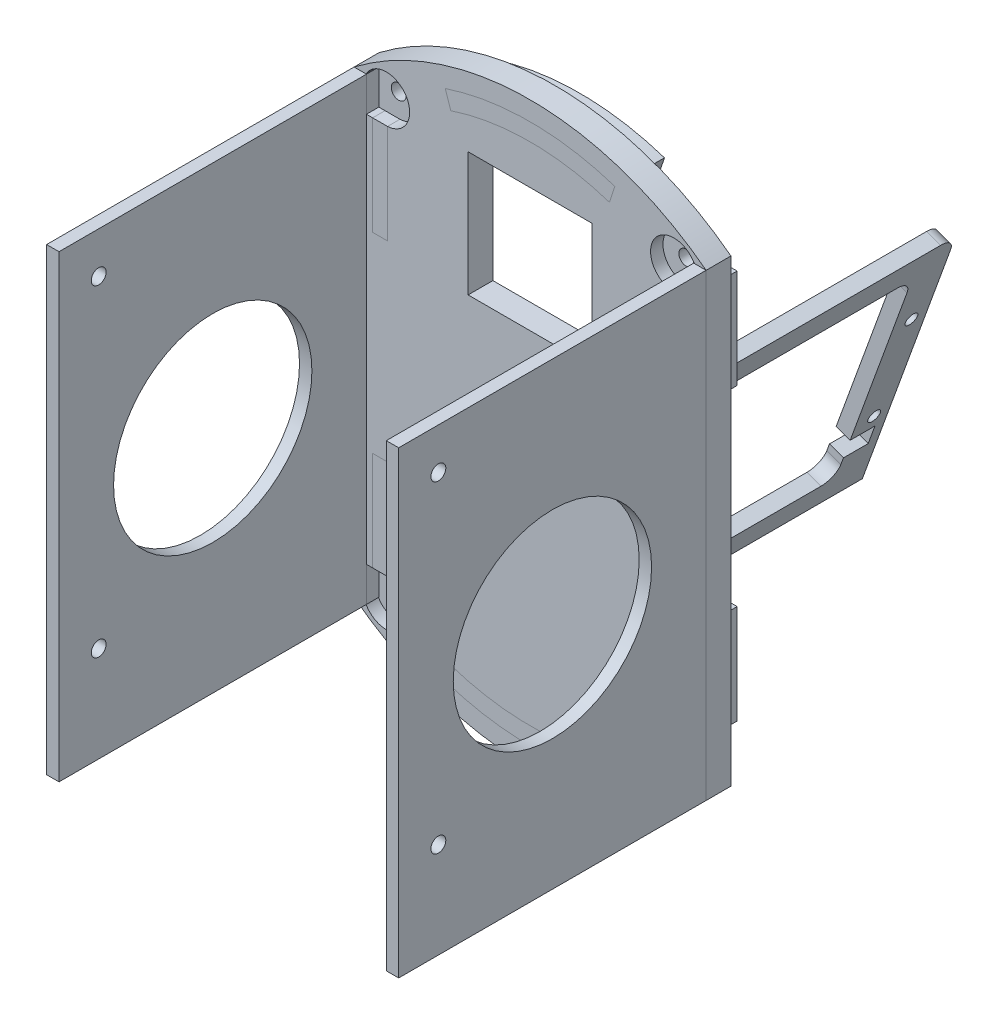
from build123d import *

# Parameters (mm, degrees)
SKETCH_3_6_R             = 1.5
SKETCH_3_6_W             = 3
SKETCH_3_6_H             = 20
SKETCH_3_6_W_2           = 25
SKETCH_3_6_H_2           = 25
EXTRUDE_4_DEPTH          = 5
EXTRUDE_START            = -65
EXTRUDE_7_DEPTH          = 65
EXTRUDE_6_DEPTH          = 62
EXTRUDE_6_2_DEPTH        = 62
SKETCH_4_R               = 1.25
CUT_EXTRUDE_2_DEPTH      = 3
CUT_EXTRUDE_3_DEPTH      = 95.282501027
CUT_EXTRUDE_3_DEPTH_BACK = 95.282501027
SKETCH_7_R               = 20
SKETCH_7_R_2             = 1.5
SKETCH_3_R               = 1.5
CUT_EXTRUDE_4_DEPTH      = 2.5
SKETCH_3_12_W            = 3
SKETCH_3_12_H            = 20
EXTRUDE_8_DEPTH          = 10
EXTRUDE_8_2_DEPTH        = 10
EXTRUDE_8_3_DEPTH        = 10
EXTRUDE_8_4_DEPTH        = 10
EXTRUDE_8_5_DEPTH        = 10
EXTRUDE_8_6_DEPTH        = 10
FILLET_1_R               = 3
FILLET_5_R               = 5
SKETCH_4_4_W             = 10
SKETCH_4_4_H             = 8
CUT_EXTRUDE_5_DEPTH      = 10


# Read off the part's stored shape, not the designer's step: 凸台-拉伸7
with BuildPart() as part:
    # 草图3<6> → 凸台-拉伸4 (new body)
    with BuildSketch(Plane.XY):
        with BuildLine():
            Line((-35.5, 46.3), (-35.5, -46.3))
            ThreePointArc((-35.5, -46.3), (0, -58.343294388), (35.5, -46.3))
            Line((35.5, -46.3), (35.5, 46.3))
            ThreePointArc((35.5, 46.3), (0, 58.343294388), (-35.5, 46.3))
        make_face()
        with Locations((-29, -44)):
            Circle(SKETCH_3_6_R, mode=Mode.SUBTRACT)
        with Locations((-30.25, -29.3)):
            Rectangle(SKETCH_3_6_W, SKETCH_3_6_H, mode=Mode.SUBTRACT)
        with BuildLine():
            ThreePointArc((17.098039216, -51.748498094), (0, -54.5), (-17.098039216, -51.748498094))
            Line((-17.098039216, -51.748498094), (-16, -48.425200051))
            ThreePointArc((-16, -48.425200051), (0, -51), (16, -48.425200051))
            Line((16, -48.425200051), (17.098039216, -51.748498094))
        make_face(mode=Mode.SUBTRACT)
        with Locations((29, -44)):
            Circle(SKETCH_3_6_R, mode=Mode.SUBTRACT)
        with Locations((30.25, -29.3)):
            Rectangle(SKETCH_3_6_W, SKETCH_3_6_H, mode=Mode.SUBTRACT)
        Polygon((1.854035127, -39.3), (1.5, -39.3), (1.5, -31.967851465), (17.99601501, 13.354577287), (20.815092873, 12.328516857), (2.00398499, -39.354577287), align=None, mode=Mode.SUBTRACT)
        with Locations((-30.25, 29.3)):
            Rectangle(SKETCH_3_6_W, SKETCH_3_6_H, mode=Mode.SUBTRACT)
        with Locations((-29, 44)):
            Circle(SKETCH_3_6_R, mode=Mode.SUBTRACT)
        with Locations((0, 30.5)):
            Rectangle(SKETCH_3_6_W_2, SKETCH_3_6_H_2, mode=Mode.SUBTRACT)
        with BuildLine():
            ThreePointArc((-17.098039216, 51.748498094), (0, 54.5), (17.098039216, 51.748498094))
            Line((17.098039216, 51.748498094), (16, 48.425200051))
            ThreePointArc((16, 48.425200051), (0, 51), (-16, 48.425200051))
            Line((-16, 48.425200051), (-17.098039216, 51.748498094))
        make_face(mode=Mode.SUBTRACT)
        with Locations((30.25, 29.3)):
            Rectangle(SKETCH_3_6_W, SKETCH_3_6_H, mode=Mode.SUBTRACT)
        with Locations((29, 44)):
            Circle(SKETCH_3_6_R, mode=Mode.SUBTRACT)
    extrude(amount=-EXTRUDE_4_DEPTH)

    # 凸台-拉伸7 outline → 凸台-拉伸7 (add)
    with BuildSketch(Plane.XY.offset(EXTRUDE_START)):
        Polygon((-0.815092873, -38.328516857), (1.5, -39.171141752), (1.5, -39.3), (1.854035127, -39.3), (2.00398499, -39.354577287), (20.815092873, 12.328516857), (17.99601501, 13.354577287), align=None)
    extrude(amount=EXTRUDE_7_DEPTH)

    # 草图4 → 切除-拉伸2 (cut)
    with BuildSketch(Plane(origin=(14.41788061, -5.247679383, 0), x_dir=(0, 0, -1), z_dir=(0.9396926207859095, -0.34202014332566566, 0))):
        Polygon((63, -23), (58, -23), (58, 13.5), (13, 13.5), (13, -31.5), (58, -31.5), (58, -27), (63, -27), align=None)
        with Locations(Location((10, -20, 0), (0, 0, 90))):
            Circle(SKETCH_4_R)
        with Locations(Location((10, 2, 0), (0, 0, 90))):
            Circle(SKETCH_4_R)
        with Locations(Location((61.8, -20, 0), (0, 0, 90))):
            Circle(SKETCH_4_R)
        with Locations(Location((61.8, 2, 0), (0, 0, 90))):
            Circle(SKETCH_4_R)
    extrude(amount=-CUT_EXTRUDE_2_DEPTH, mode=Mode.SUBTRACT)

    # 草图3 → 切除-拉伸4 (cut)
    # profile 1 of 8: a face of its own
    with BuildSketch(Plane.XY):
        with BuildLine():
            Line((-24.893602552, 46.3), (-33, 46.3))
            Line((-33, 46.3), (-33, 39.3))
            Line((-33, 39.3), (-31.75, 39.3))
            Line((-31.75, 39.3), (-28.75, 39.3))
            ThreePointArc((-28.75, 39.3), (-24.877555376, 41.728887867), (-24.893602552, 46.3))
        make_face()
        with Locations((-29, 44)):
            Circle(SKETCH_3_R, mode=Mode.SUBTRACT)
    # profile 2 of 8: a face of its own
    with BuildSketch(Plane.XY):
        with BuildLine():
            ThreePointArc((-26.20469003, 47.786653162), (-29.991096362, 48.601111605), (-33.106397448, 46.3))
            Line((-33.106397448, 46.3), (-33, 46.3))
            Line((-33, 46.3), (-24.893602552, 46.3))
            ThreePointArc((-24.893602552, 46.3), (-25.469996356, 47.113129338), (-26.20469003, 47.786653162))
        make_face()
    # profile 3 of 8: a face of its own
    with BuildSketch(Plane.XY):
        with BuildLine():
            Line((33, 39.3), (33, 46.3))
            Line((33, 46.3), (24.893602552, 46.3))
            ThreePointArc((24.893602552, 46.3), (24.877555376, 41.728887867), (28.75, 39.3))
            Line((28.75, 39.3), (31.75, 39.3))
            Line((31.75, 39.3), (33, 39.3))
        make_face()
        with Locations((29, 44)):
            Circle(SKETCH_3_R, mode=Mode.SUBTRACT)
    # profile 4 of 8: a face of its own
    with BuildSketch(Plane.XY):
        with BuildLine():
            Line((33, 46.3), (33.106397448, 46.3))
            ThreePointArc((33.106397448, 46.3), (29.991096362, 48.601111605), (26.20469003, 47.786653162))
            ThreePointArc((26.20469003, 47.786653162), (25.469996356, 47.113129338), (24.893602552, 46.3))
            Line((24.893602552, 46.3), (33, 46.3))
        make_face()
    # profile 5 of 8: a face of its own
    with BuildSketch(Plane.XY):
        with BuildLine():
            Line((24.893602552, -46.3), (33, -46.3))
            Line((33, -46.3), (33, -39.3))
            Line((33, -39.3), (31.75, -39.3))
            Line((31.75, -39.3), (28.75, -39.3))
            ThreePointArc((28.75, -39.3), (24.877555376, -41.728887867), (24.893602552, -46.3))
        make_face()
        with Locations((29, -44)):
            Circle(SKETCH_3_R, mode=Mode.SUBTRACT)
    # profile 6 of 8: a face of its own
    with BuildSketch(Plane.XY):
        with BuildLine():
            ThreePointArc((26.20469003, -47.786653162), (29.991096362, -48.601111605), (33.106397448, -46.3))
            Line((33.106397448, -46.3), (33, -46.3))
            Line((33, -46.3), (24.893602552, -46.3))
            ThreePointArc((24.893602552, -46.3), (25.469996356, -47.113129338), (26.20469003, -47.786653162))
        make_face()
    # profile 7 of 8: a face of its own
    with BuildSketch(Plane.XY):
        with BuildLine():
            Line((-33, -39.3), (-33, -46.3))
            Line((-33, -46.3), (-24.893602552, -46.3))
            ThreePointArc((-24.893602552, -46.3), (-24.877555376, -41.728887867), (-28.75, -39.3))
            Line((-28.75, -39.3), (-31.75, -39.3))
            Line((-31.75, -39.3), (-33, -39.3))
        make_face()
        with Locations((-29, -44)):
            Circle(SKETCH_3_R, mode=Mode.SUBTRACT)
    # profile 8 of 8: a face of its own
    with BuildSketch(Plane.XY):
        with BuildLine():
            Line((-33, -46.3), (-33.106397448, -46.3))
            ThreePointArc((-33.106397448, -46.3), (-29.991096362, -48.601111605), (-26.20469003, -47.786653162))
            ThreePointArc((-26.20469003, -47.786653162), (-25.469996356, -47.113129338), (-24.893602552, -46.3))
            Line((-24.893602552, -46.3), (-33, -46.3))
        make_face()
    extrude(amount=-CUT_EXTRUDE_4_DEPTH, mode=Mode.SUBTRACT)

    # 圆角1
    fillet_1_edges = [part.edges().sort_by_distance(p)[0] for p in [
        (0.342453564, -38.749829304, -65),
        (19.405553942, 12.841547072, -65),
        (17.625613613, 7.951201212, -13),
        (17.625613613, 7.951201212, -58),
        (2.234707164, -34.334966723, -58),
        (2.234707164, -34.334966723, -13),
    ]]
    fillet(fillet_1_edges, radius=FILLET_1_R)

    # 圆角5
    # the kernel refuses this fillet: 5 mm, written as the material it adds along each edge
    with BuildSketch(Plane(origin=(20.815092873, 12.328516857, -5), x_dir=(4.0352212111646156e-11, -1.4687004095435187e-11, -1.0), z_dir=(-0.3420201433256656, -0.9396926207859095, 0))) as fillet_5_piece_1_section:
        with BuildLine():
            CenterArc((FILLET_5_R, FILLET_5_R), FILLET_5_R, 179.999999998, 90)
            Line((FILLET_5_R * 4.29419272013e-11, FILLET_5_R), (0, 0))
            Line((0, 0), (FILLET_5_R, 0))
        make_face()
    fillet_5_piece_1 = extrude(amount=55, mode=Mode.PRIVATE)
    fillet_5_piece_1 = fillet_5_piece_1 - Plane(origin=(8.643311737, -24.429463647, -10), x_dir=(0.34202014332566566, 0.9396926207859095, 0), z_dir=(0.9396926207859095, -0.34202014332566566, 0)) * Cylinder(1.25, 131, mode=Mode.PRIVATE)
    fillet_5_piece_1 = fillet_5_piece_1 - Plane(origin=(16.16775489, -3.75622599, -10), x_dir=(0.34202014332566566, 0.9396926207859095, 0), z_dir=(0.9396926207859095, -0.34202014332566566, 0)) * Cylinder(1.25, 131, mode=Mode.PRIVATE)
    add(fillet_5_piece_1)

    # 草图4<4> → 切除-拉伸5 (cut)
    with BuildSketch(Plane(origin=(14.41788061, -5.247679383, 0), x_dir=(0, 0, -1), z_dir=(0.9396926207859095, -0.34202014332566566, 0))):
        with Locations((10, -20)):
            Rectangle(SKETCH_4_4_W, SKETCH_4_4_H)
        with Locations((10, 2)):
            Rectangle(SKETCH_4_4_W, SKETCH_4_4_H)
    extrude(amount=CUT_EXTRUDE_5_DEPTH, mode=Mode.SUBTRACT)


with BuildPart() as body_2:
    # 草图3<8> → 凸台-拉伸6 (new body)
    with BuildSketch(Plane.XY):
        Polygon((-35.5, 46.3), (-35.5, -46.3), (-33.106397448, -46.3), (-33, -46.3), (-33, -39.3), (-33, 39.3), (-33, 46.3), (-33.106397448, 46.3), align=None)
    extrude(amount=EXTRUDE_6_DEPTH)


with BuildPart() as body_3:
    # 草图3<8> → Extrude 6 2 (new body)
    with BuildSketch(Plane.XY):
        Polygon((33.106397448, -46.3), (35.5, -46.3), (35.5, 46.3), (33.106397448, 46.3), (33, 46.3), (33, 39.3), (33, -39.3), (33, -46.3), align=None)
    extrude(amount=EXTRUDE_6_2_DEPTH)


with BuildPart() as cut_extrude_3_tool:
    # 草图7 → 切除-拉伸3 (new, two sides: drawn at the far end of the back side and taken through both)
    with BuildSketch(Plane(origin=(0, 0, 0), x_dir=(0, 0, -1), z_dir=(1, 0, 0)).offset(-CUT_EXTRUDE_3_DEPTH_BACK)):
        with Locations((-31, 0)):
            Circle(SKETCH_7_R)
        with Locations((-54, 38)):
            Circle(SKETCH_7_R_2)
        with Locations((-54, -27)):
            Circle(SKETCH_7_R_2)
    extrude(amount=CUT_EXTRUDE_3_DEPTH + CUT_EXTRUDE_3_DEPTH_BACK)


with BuildPart() as body_2_1:
    add(body_2.part)

    # 切除-拉伸3: cut by cut_extrude_3_tool
    add(cut_extrude_3_tool.part, mode=Mode.SUBTRACT)


with BuildPart() as body_3_1:
    add(body_3.part)

    # 切除-拉伸3: cut by cut_extrude_3_tool
    add(cut_extrude_3_tool.part, mode=Mode.SUBTRACT)


with BuildPart() as body_4:
    # 草图3<12> → 凸台-拉伸8 (new body)
    with BuildSketch(Plane.XY):
        with Locations((-30.25, 29.3)):
            Rectangle(SKETCH_3_12_W, SKETCH_3_12_H)
    extrude(amount=-EXTRUDE_8_DEPTH)


with BuildPart() as body_5:
    # 草图3<12> → Extrude 8 2 (new body)
    with BuildSketch(Plane.XY):
        with BuildLine():
            ThreePointArc((17.098039216, 51.748498094), (0, 54.5), (-17.098039216, 51.748498094))
            Line((-17.098039216, 51.748498094), (-16, 48.425200051))
            ThreePointArc((-16, 48.425200051), (0, 51), (16, 48.425200051))
            Line((16, 48.425200051), (17.098039216, 51.748498094))
        make_face()
    extrude(amount=-EXTRUDE_8_2_DEPTH)


with BuildPart() as body_6:
    # 草图3<12> → Extrude 8 3 (new body)
    with BuildSketch(Plane.XY):
        with Locations((30.25, 29.3)):
            Rectangle(SKETCH_3_12_W, SKETCH_3_12_H)
    extrude(amount=-EXTRUDE_8_3_DEPTH)


with BuildPart() as body_7:
    # 草图3<12> → Extrude 8 4 (new body)
    with BuildSketch(Plane.XY):
        with Locations((30.25, -29.3)):
            Rectangle(SKETCH_3_12_W, SKETCH_3_12_H)
    extrude(amount=-EXTRUDE_8_4_DEPTH)


with BuildPart() as body_8:
    # 草图3<12> → Extrude 8 5 (new body)
    with BuildSketch(Plane.XY):
        with Locations((-30.25, -29.3)):
            Rectangle(SKETCH_3_12_W, SKETCH_3_12_H)
    extrude(amount=-EXTRUDE_8_5_DEPTH)


with BuildPart() as body_9:
    # 草图3<12> → Extrude 8 6 (new body)
    with BuildSketch(Plane.XY):
        with BuildLine():
            Line((-16, -48.425200051), (-17.098039216, -51.748498094))
            ThreePointArc((-17.098039216, -51.748498094), (0, -54.5), (17.098039216, -51.748498094))
            Line((17.098039216, -51.748498094), (16, -48.425200051))
            ThreePointArc((16, -48.425200051), (0, -51), (-16, -48.425200051))
        make_face()
    extrude(amount=-EXTRUDE_8_6_DEPTH)


solid = Compound([part.part, body_2_1.part, body_3_1.part, body_4.part, body_5.part, body_6.part, body_7.part, body_8.part, body_9.part])
